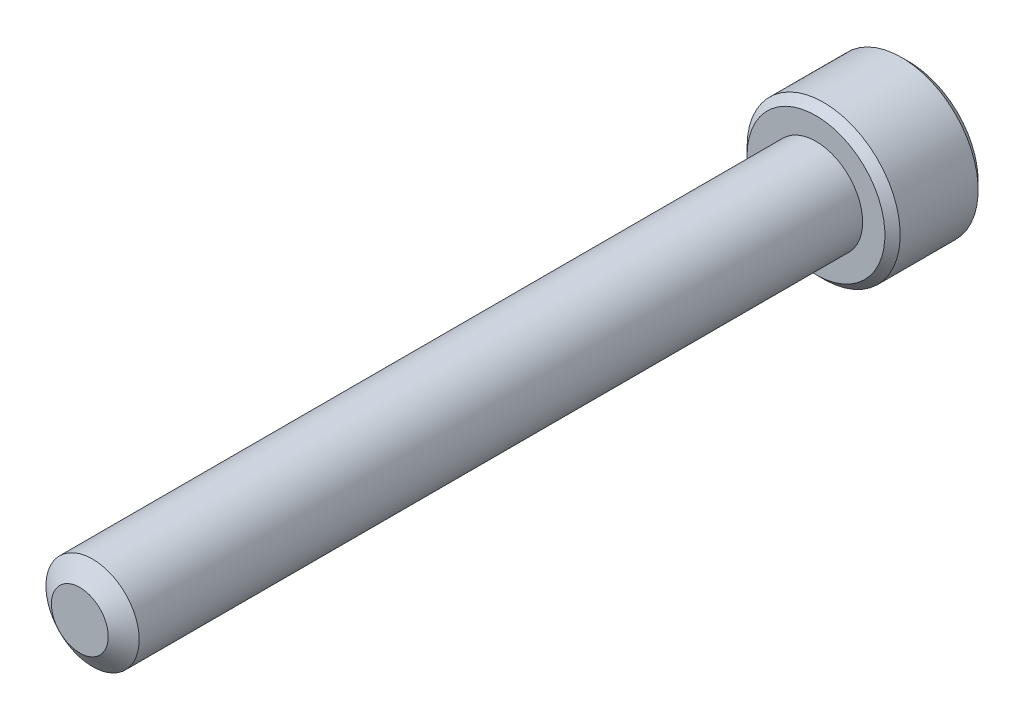
from build123d import *

# Parameters (mm, degrees)
SKETCH1_R          = 2.413
EXTRUDE1_DEPTH     = 38.1
SKETCH6_R          = 3.9624
EXTRUDE2_DEPTH     = 4.826
CUT_EXTRUDE1_DEPTH = 2.9765625
CHAMFER1_SIZE      = 0.39624


with BuildPart() as part:
    # Sketch1 → Extrude1 (new body)
    with BuildSketch(Plane.XY):
        Circle(SKETCH1_R)
    extrude(amount=-EXTRUDE1_DEPTH)

    # Sketch4 → Cut-Revolve1 (revolve, cut)
    with BuildSketch(Plane(origin=(0, 0, 0), x_dir=(0, 0, -1), z_dir=(1, 0, 0))):
        Polygon((0.659180743, 2.413), (0, 1.471592336), (0, 2.413), align=None)
    revolve(axis=Axis((0, 0, 0), (0, 0, -1)), mode=Mode.SUBTRACT)

    # Sketch6 → Extrude2 (add)
    with BuildSketch(Plane(origin=(0, 0, -38.1), x_dir=(-1, 0, 0), z_dir=(0, 0, -1))):
        Circle(SKETCH6_R)
    extrude(amount=EXTRUDE2_DEPTH)

    # Sketch7 → Cut-Extrude1 (cut)
    with BuildSketch(Plane(origin=(0, 0, -42.926), x_dir=(-1, 0, 0), z_dir=(0, 0, -1))):
        Polygon((0, 2.291358881), (-1.984375, 1.14567944), (-1.984375, -1.14567944), (0, -2.291358881), (1.984375, -1.14567944), (1.984375, 1.14567944), align=None)
    extrude(amount=-CUT_EXTRUDE1_DEPTH, mode=Mode.SUBTRACT)

    # Cut-Extrude2 cone 1 section (through the dimple's axis) → Cut-Extrude2 (revolve, cut)
    with BuildSketch(Plane(origin=(0, 0, -42.926), x_dir=(0, 1, 0), z_dir=(1, 0, 0))):
        Polygon((0, 0), (2.291358881, 0), (0, 2.291358881), align=None)
    revolve(axis=Axis((0, 0, -42.926), (0, 0, 1)), mode=Mode.SUBTRACT)

    # Chamfer1
    chamfer1_edges = [part.edges().sort_by_distance(p)[0] for p in [
        (3.9624, 0, -42.926),
        (3.9624, 0, -38.1),
    ]]
    chamfer(chamfer1_edges, length=CHAMFER1_SIZE)


solid = part.part
